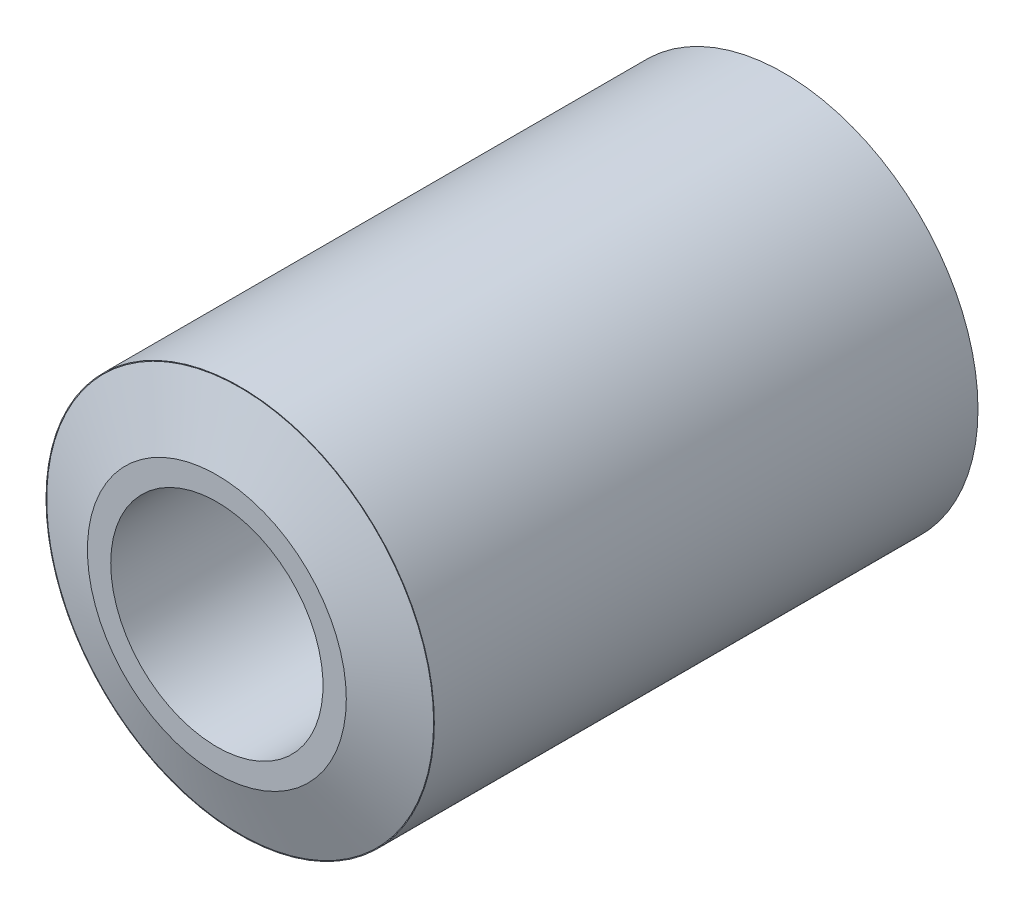
from build123d import *
from OCP.BRepFilletAPI import BRepFilletAPI_MakeChamfer

# Parameters (mm, degrees)
SKETCH1_R           = 7.5
SKETCH1_R_2         = 4.1
BOSS_EXTRUDE1_DEPTH = 21
BOSS_EXTRUDE2_START = -0.9
SKETCH2_R           = 5
SKETCH2_R_2         = 4.1
BOSS_EXTRUDE2_DEPTH = 22.8
CHAMFER1_SIZE       = 0.9
CHAMFER1_SIZE_2     = 2.472729678


with BuildPart() as part:
    # Sketch1 → Boss-Extrude1 (new body)
    with BuildSketch(Plane.XY):
        with Locations(Location((0, 0, 0), (0, 0, 180))):
            Circle(SKETCH1_R)
        with Locations(Location((0, 0, 0), (0, 0, 180))):
            Circle(SKETCH1_R_2, mode=Mode.SUBTRACT)
    extrude(amount=BOSS_EXTRUDE1_DEPTH)

    # Sketch2 → Boss-Extrude2 (add)
    with BuildSketch(Plane.XY.offset(BOSS_EXTRUDE2_START)):
        Circle(SKETCH2_R)
        with Locations(Location((0, 0, 0), (0, 0, 180))):
            Circle(SKETCH2_R_2, mode=Mode.SUBTRACT)
    extrude(amount=BOSS_EXTRUDE2_DEPTH)

    # Chamfer1
    chamfer1_edges_1 = [part.edges().sort_by_distance(p)[0] for p in [
        (-5, 0, 0),
    ]]
    chamfer1_side_1 = [part.faces().sort_by_distance(p)[0] for p in [
        (-5, 0, -0.018),
    ]]
    chamfer1_edges_2 = [part.edges().sort_by_distance(p)[0] for p in [
        (-5, 0, 21),
    ]]
    chamfer1_side_2 = [part.faces().sort_by_distance(p)[0] for p in [
        (-5.018, 0, 21),
    ]]
    chamfer1 = BRepFilletAPI_MakeChamfer(part.part.solid().wrapped)
    for e in chamfer1_edges_1:
        chamfer1.Add(CHAMFER1_SIZE - 0.0001, CHAMFER1_SIZE_2 - 0.0001, e.wrapped, chamfer1_side_1[0].wrapped)
    for e in chamfer1_edges_2:
        chamfer1.Add(CHAMFER1_SIZE_2 - 0.0001, CHAMFER1_SIZE - 0.0001, e.wrapped, chamfer1_side_2[0].wrapped)
    add(Compound.cast(chamfer1.Shape()), mode=Mode.REPLACE)  # a hair under: the kernel refuses the full size


solid = part.part
